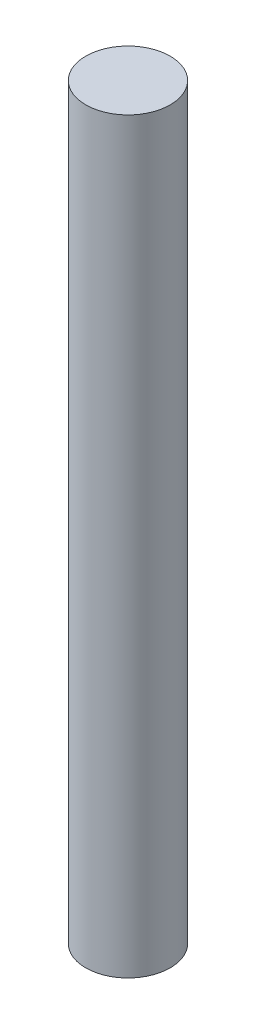
from build123d import *

# Parameters (mm, degrees)
CROQUIS1_R              = 4
SALIENTE_EXTRUIR1_DEPTH = 100
CROQUIS2_W              = 17.968690684
CROQUIS2_H              = 31.653106042
CORTAR_EXTRUIR1_DEPTH   = 23


with BuildPart() as part:
    # Croquis1 → Saliente-Extruir1 (new body)
    with BuildSketch(Plane(origin=(0, 0, 0), x_dir=(1, 0, 0), z_dir=(0, 1, 0))):
        Circle(CROQUIS1_R)
    extrude(amount=SALIENTE_EXTRUIR1_DEPTH)

    # Croquis2 → Cortar-Extruir1 (cut)
    with BuildSketch(Plane(origin=(-3.19492812, 0, 2.406747662), x_dir=(0.6016869154552409, 0, 0.798732030013795), z_dir=(-0.798732030013795, 0, 0.6016869154552409))):
        with Locations((0.165622699, 13.369561391)):
            Rectangle(CROQUIS2_W, CROQUIS2_H)
    extrude(amount=-CORTAR_EXTRUIR1_DEPTH, mode=Mode.SUBTRACT)


solid = part.part
